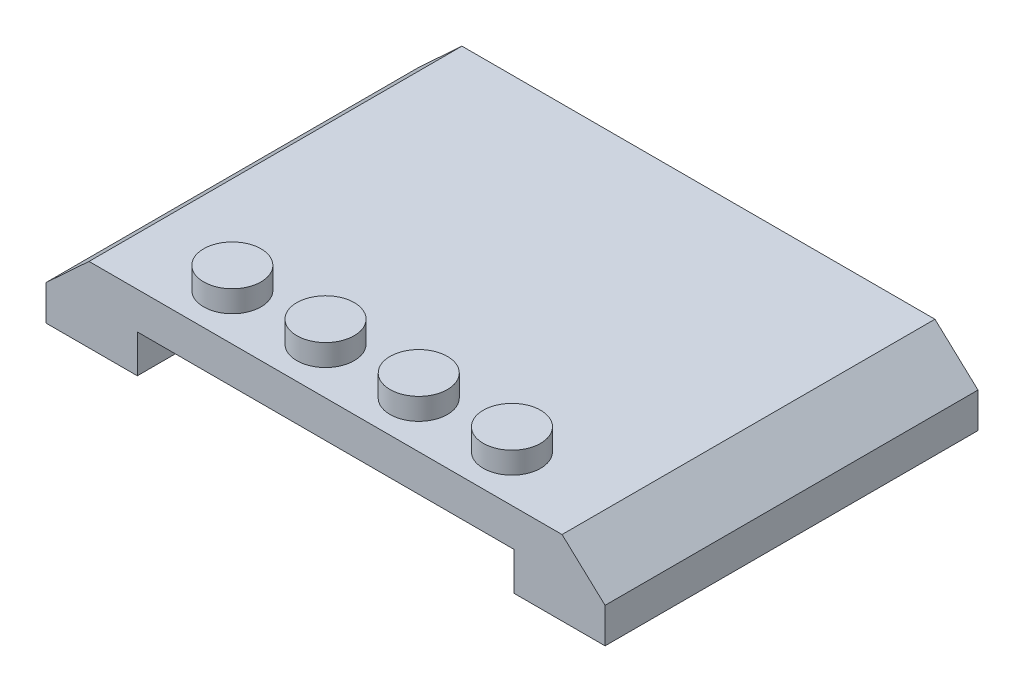
from build123d import *

# Parameters (mm, degrees)
BOSS_EXTRUDE1_DEPTH     = 31.85
CUT_EXTRUDE1_DEPTH      = 41.316226572
CUT_EXTRUDE1_DEPTH_BACK = 24.55
SHELL1_START            = -30.25
SHELL1_DEPTH            = 28.65
SHELL1_2_OUTLINE_W      = 35.35
SHELL1_2_OUTLINE_H      = 4.8
SHELL1_2_DEPTH          = 4.1
BOSS_EXTRUDE2_START     = -4.6
SKETCH3_R               = 1.5
SKETCH3_R_2             = 0.55
BOSS_EXTRUDE2_DEPTH     = 4.6
SKETCH4_W               = 32.15
SKETCH4_H               = 17.25
CUT_EXTRUDE2_DEPTH      = 1.95
SKETCH5_W               = 32.15
SKETCH5_H               = 4.65
CUT_EXTRUDE3_DEPTH      = 2.25
SKETCH6_R               = 2.45
BOSS_EXTRUDE3_DEPTH     = 1.85
SKETCH7_R               = 0.95
CUT_EXTRUDE4_DEPTH      = 1.65


# Read off the part's stored shape, not the designer's step: Shell1
with BuildPart() as part:
    # Sketch1 → Boss-Extrude1 (new body)
    with BuildSketch(Plane.XY):
        Polygon((23.875, 0), (23.875, 3), (20.2, 6.4), (-20.2, 6.4), (-23.875, 3), (-23.875, 0), align=None)
    extrude(amount=-BOSS_EXTRUDE1_DEPTH)

    # Sketch2 → Cut-Extrude1 (cut, two sides: drawn at the far end of the back side and taken through both)
    with BuildSketch(Plane.XY.offset(-CUT_EXTRUDE1_DEPTH_BACK)):
        Polygon((-16.075, -90.918786447), (-16.075, 0), (-16.075, 3.25), (16.075, 3.25), (16.075, 0), (16.075, -90.918786447), (16.075, -272.75635934), (-16.075, -272.75635934), align=None)
    extrude(amount=CUT_EXTRUDE1_DEPTH + CUT_EXTRUDE1_DEPTH_BACK, mode=Mode.SUBTRACT)

    # Shell1 outline → Shell1 (cut)
    with BuildSketch(Plane.XY.offset(SHELL1_START)):
        Polygon((22.275, 2.30054609), (19.573384377, 4.8), (17.675, 4.8), (17.675, 0), (22.275, 0), align=None)
        Polygon((-17.675, 0), (-17.675, 4.8), (-19.573384377, 4.8), (-22.275, 2.30054609), (-22.275, 0), align=None)
    extrude(amount=SHELL1_DEPTH, mode=Mode.SUBTRACT)

    # Shell1 2 outline → Shell1 2 (cut)
    with BuildSketch(Plane.XY.offset(SHELL1_START)):
        with Locations((0, 2.4)):
            Rectangle(SHELL1_2_OUTLINE_W, SHELL1_2_OUTLINE_H)
    extrude(amount=SHELL1_2_DEPTH, mode=Mode.SUBTRACT)

    # Sketch3 → Boss-Extrude2 (add)
    # profile 1 of 6: a face of its own
    with BuildSketch(Plane(origin=(0, 0.2, 0), x_dir=(-1, 0, 0), z_dir=(0, -1, 0)).offset(BOSS_EXTRUDE2_START)):
        with Locations(Location((19.975, 7.9625, 0), (0, 0, 90))):
            Circle(SKETCH3_R)
        with Locations(Location((19.975, 7.9625, 0), (0, 0, 90))):
            Circle(SKETCH3_R_2, mode=Mode.SUBTRACT)
    # profile 2 of 6: a face of its own
    with BuildSketch(Plane(origin=(0, 0.2, 0), x_dir=(-1, 0, 0), z_dir=(0, -1, 0)).offset(BOSS_EXTRUDE2_START)):
        with Locations(Location((19.975, 15.925, 0), (0, 0, 90))):
            Circle(SKETCH3_R)
        with Locations(Location((19.975, 15.925, 0), (0, 0, 90))):
            Circle(SKETCH3_R_2, mode=Mode.SUBTRACT)
    # profile 3 of 6: a face of its own
    with BuildSketch(Plane(origin=(0, 0.2, 0), x_dir=(-1, 0, 0), z_dir=(0, -1, 0)).offset(BOSS_EXTRUDE2_START)):
        with Locations(Location((19.975, 23.8875, 0), (0, 0, 90))):
            Circle(SKETCH3_R)
        with Locations(Location((19.975, 23.8875, 0), (0, 0, 90))):
            Circle(SKETCH3_R_2, mode=Mode.SUBTRACT)
    # profile 4 of 6: a face of its own
    with BuildSketch(Plane(origin=(0, 0.2, 0), x_dir=(-1, 0, 0), z_dir=(0, -1, 0)).offset(BOSS_EXTRUDE2_START)):
        with Locations(Location((-19.975, 23.8875, 0), (0, 0, 74.469949242))):
            Circle(SKETCH3_R)
        with Locations(Location((-19.975, 23.8875, 0), (0, 0, 43.095979253))):
            Circle(SKETCH3_R_2, mode=Mode.SUBTRACT)
    # profile 5 of 6: a face of its own
    with BuildSketch(Plane(origin=(0, 0.2, 0), x_dir=(-1, 0, 0), z_dir=(0, -1, 0)).offset(BOSS_EXTRUDE2_START)):
        with Locations(Location((-19.975, 15.925, 0), (0, 0, 74.469949242))):
            Circle(SKETCH3_R)
        with Locations(Location((-19.975, 15.925, 0), (0, 0, 43.095979253))):
            Circle(SKETCH3_R_2, mode=Mode.SUBTRACT)
    # profile 6 of 6: a face of its own
    with BuildSketch(Plane(origin=(0, 0.2, 0), x_dir=(-1, 0, 0), z_dir=(0, -1, 0)).offset(BOSS_EXTRUDE2_START)):
        with Locations(Location((-19.975, 7.9625, 0), (0, 0, 74.469949242))):
            Circle(SKETCH3_R)
        with Locations(Location((-19.975, 7.9625, 0), (0, 0, 43.095979253))):
            Circle(SKETCH3_R_2, mode=Mode.SUBTRACT)
    extrude(amount=BOSS_EXTRUDE2_DEPTH)

    # Sketch4 → Cut-Extrude2 (cut)
    with BuildSketch(Plane.XZ.offset(-3.25)):
        with Locations((0, -15.925)):
            Rectangle(SKETCH4_W, SKETCH4_H)
    extrude(amount=-CUT_EXTRUDE2_DEPTH, mode=Mode.SUBTRACT)

    # Sketch5 → Cut-Extrude3 (cut)
    with BuildSketch(Plane.XZ.offset(-3.25)):
        with Locations((0, -3.825)):
            Rectangle(SKETCH5_W, SKETCH5_H)
    extrude(amount=-CUT_EXTRUDE3_DEPTH, mode=Mode.SUBTRACT)

    # Sketch6 → Boss-Extrude3 (add)
    with BuildSketch(Plane(origin=(0, 6.4, 0), x_dir=(1, 0, 0), z_dir=(0, 1, 0))):
        with Locations(Location((-3.98, 3.98, 0), (0, 0, 270))):
            Circle(SKETCH6_R)
        with Locations(Location((3.98, 3.98, 0), (0, 0, 270))):
            Circle(SKETCH6_R)
        with Locations(Location((-11.94, 3.98, 0), (0, 0, 270))):
            Circle(SKETCH6_R)
        with Locations(Location((11.94, 3.98, 0), (0, 0, 270))):
            Circle(SKETCH6_R)
    extrude(amount=BOSS_EXTRUDE3_DEPTH)

    # Sketch7 → Cut-Extrude4 (cut)
    with BuildSketch(Plane.XZ.offset(-5.5)):
        with Locations(Location((-11.94, -3.98, 0), (0, 0, 270))):
            Circle(SKETCH7_R)
        with Locations(Location((-3.98, -3.98, 0), (0, 0, 270))):
            Circle(SKETCH7_R)
        with Locations(Location((3.98, -3.98, 0), (0, 0, 270))):
            Circle(SKETCH7_R)
        with Locations(Location((11.94, -3.98, 0), (0, 0, 270))):
            Circle(SKETCH7_R)
    extrude(amount=-CUT_EXTRUDE4_DEPTH, mode=Mode.SUBTRACT)


solid = part.part
